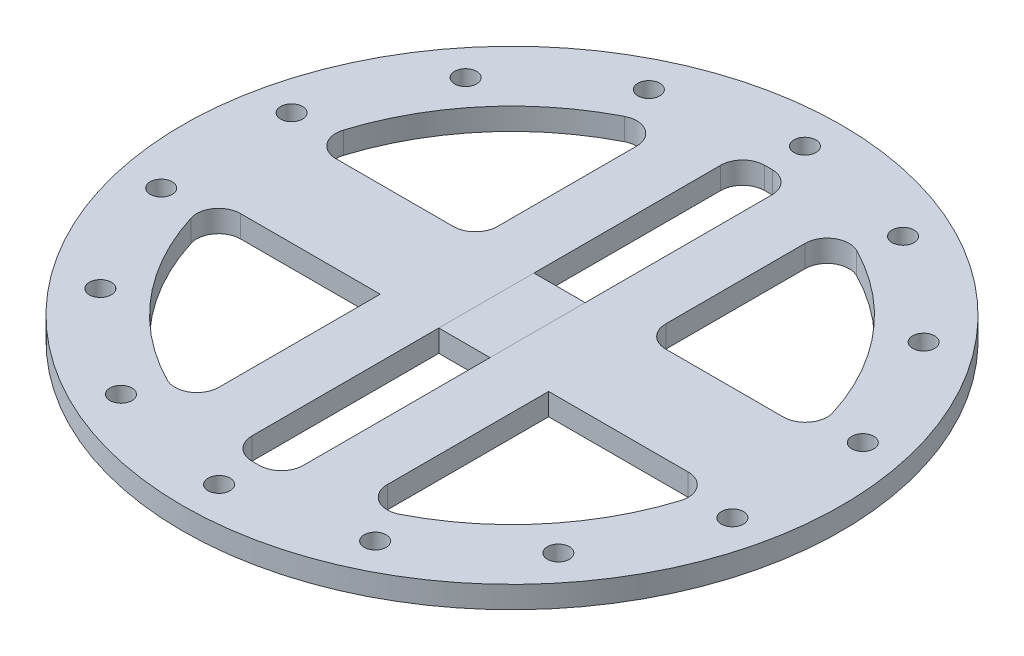
from build123d import *

# Parameters (mm, degrees)
SKETCH_1_R               = 45
SKETCH_1_R_2             = 35
EXTRUDE_1_DEPTH          = 3
EXTRUDE_2_DEPTH          = 3
SKETCH_3_R               = 1.5
CUT_EXTRUDE_1_DEPTH      = 3
PATTERN_CIRCULAR_1_COUNT = 14
FILLET_1_R               = 3
EXTRUDE_3_DEPTH          = 3
FILLET_2_R               = 3
MIRROR_1_DEPTH           = 3


# Read off the part's stored shape, not the designer's step: Зеркальное отражение1
with BuildPart() as part:
    # Эскиз1 → Бобышка-Вытянуть1 (new body)
    with BuildSketch(Plane(origin=(0, 0, 0), x_dir=(1, 0, 0), z_dir=(0, 1, 0))):
        with Locations(Location((0, 0, 0), (0, 0, 270))):
            Circle(SKETCH_1_R)
        with Locations(Location((0, 0, 0), (0, 0, 270))):
            Circle(SKETCH_1_R_2, mode=Mode.SUBTRACT)
    extrude(amount=EXTRUDE_1_DEPTH)

    # Эскиз2 → Бобышка-Вытянуть2 (add)
    with BuildSketch(Plane(origin=(0, 0, 0), x_dir=(1, 0, 0), z_dir=(0, 1, 0))):
        with BuildLine():
            ThreePointArc((-34.391132578, 6.5), (-34.847450698, 3.264227303), (-35, 0))
            Line((-35, 0), (35, 0))
            ThreePointArc((35, 0), (34.847450698, 3.264227303), (34.391132578, 6.5))
            Line((34.391132578, 6.5), (-34.391132578, 6.5))
        make_face()
        with BuildLine():
            Line((35, 0), (-35, 0))
            ThreePointArc((-35, 0), (-34.847450698, -3.264227303), (-34.391132578, -6.5))
            Line((-34.391132578, -6.5), (34.391132578, -6.5))
            ThreePointArc((34.391132578, -6.5), (34.847450698, -3.264227303), (35, 0))
        make_face()
    extrude(amount=EXTRUDE_2_DEPTH)

    # Эскиз3 → Вырез-Вытянуть1 (cut)
    with BuildSketch(Plane(origin=(0, 3, 0), x_dir=(1, 0, 0), z_dir=(0, 1, 0))):
        with Locations(Location((0, 40, 0), (0, 0, 270))):
            Circle(SKETCH_3_R)
    cut_extrude_1 = extrude(amount=-CUT_EXTRUDE_1_DEPTH, mode=Mode.SUBTRACT)

    # Круговой массив1: Вырез-Вытянуть1 ×14 about axis
    pattern_circular_1_axis = Axis((0, 0, 0), (0, 1, 0))
    for i in range(1, PATTERN_CIRCULAR_1_COUNT):
        add(cut_extrude_1.rotate(pattern_circular_1_axis, i * 360 / PATTERN_CIRCULAR_1_COUNT), mode=Mode.SUBTRACT)

    # Скругление1
    fillet_1_edges = [part.edges().sort_by_distance(p)[0] for p in [
        (-34.391132578, 1.5, -6.5),
        (-34.391132578, 1.5, 6.5),
        (34.391132578, 1.5, 6.5),
        (34.391132578, 1.5, -6.5),
    ]]
    fillet(fillet_1_edges, radius=FILLET_1_R)

    # Эскиз4 → Бобышка-Вытянуть3 (add)
    with BuildSketch(Plane(origin=(0, 0, 0), x_dir=(1, 0, 0), z_dir=(0, 1, 0))):
        with BuildLine():
            Line((-3.5, 6.5), (-3.5, 34.824560299))
            ThreePointArc((-3.5, 34.824560299), (-7.551905138, 34.175557476), (-11.5, 33.056769352))
            Line((-11.5, 33.056769352), (-11.5, 6.5))
            Line((-11.5, 6.5), (-3.5, 6.5))
        make_face()
        with BuildLine():
            Line((3.5, 6.5), (3.5, 34.824560299))
            ThreePointArc((3.5, 34.824560299), (7.551905138, 34.175557476), (11.5, 33.056769352))
            Line((11.5, 33.056769352), (11.5, 6.5))
            Line((11.5, 6.5), (3.5, 6.5))
        make_face()
    extrude(amount=EXTRUDE_3_DEPTH)

    # Скругление2
    fillet_2_edges = [part.edges().sort_by_distance(p)[0] for p in [
        (-11.5, 1.5, -6.5),
        (-3.5, 1.5, -34.824560299),
        (-11.5, 1.5, -33.056769352),
        (11.5, 1.5, -6.5),
        (11.5, 1.5, -33.056769352),
        (3.5, 1.5, -34.824560299),
    ]]
    fillet(fillet_2_edges, radius=FILLET_2_R)

    # Зеркальное отражение1 outline → Зеркальное отражение1 (add)
    with BuildSketch(Plane(origin=(0, 0, 0), x_dir=(1, 0, 0), z_dir=(0, 1, 0))):
        with BuildLine():
            ThreePointArc((-0.546875, -34.995727278), (-2.637828922, -34.100775792), (-3.5, -31.996093512))
            Line((-3.5, -31.996093512), (-3.5, -6.5))
            Line((-3.5, -6.5), (-11.5, -6.5))
            Line((-11.5, -6.5), (-11.5, -28.526303651))
            ThreePointArc((-11.5, -28.526303651), (-12.93126245, -31.083462719), (-15.859375, -31.200644618))
            ThreePointArc((-15.859375, -31.200644618), (-8.419734133, -33.972166212), (-0.546875, -34.995727278))
        make_face()
        with BuildLine():
            Line((11.5, -6.5), (3.5, -6.5))
            Line((3.5, -6.5), (3.5, -31.996093512))
            ThreePointArc((3.5, -31.996093512), (2.637828922, -34.100775792), (0.546875, -34.995727278))
            ThreePointArc((0.546875, -34.995727278), (8.419734133, -33.972166212), (15.859375, -31.200644618))
            ThreePointArc((15.859375, -31.200644618), (12.93126245, -31.083462719), (11.5, -28.526303651))
            Line((11.5, -28.526303651), (11.5, -6.5))
        make_face()
    extrude(amount=MIRROR_1_DEPTH)


solid = part.part
